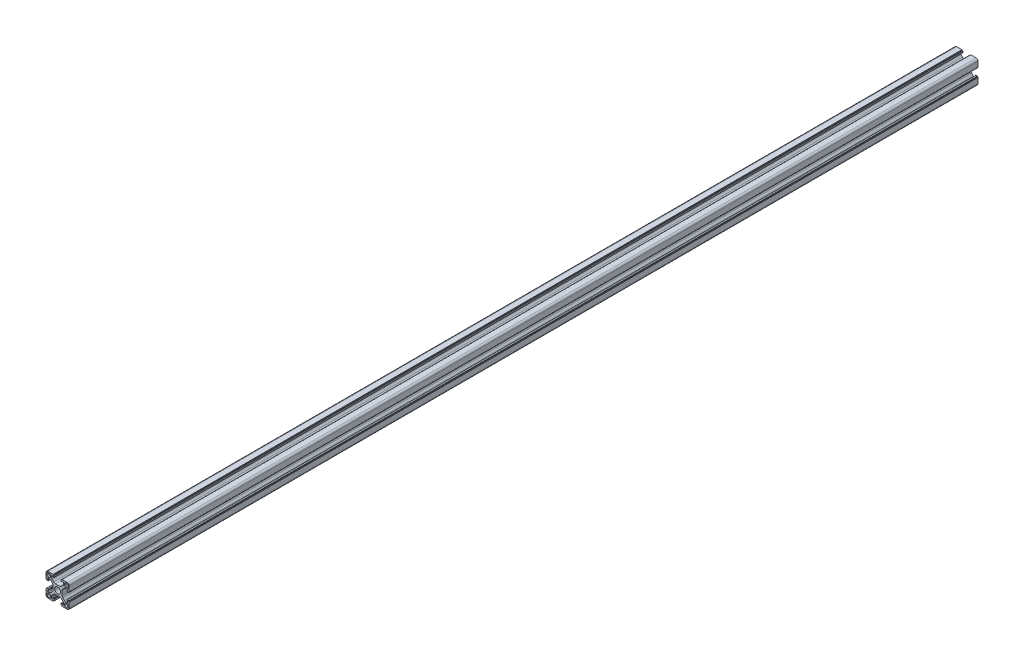
from build123d import *

# Parameters (mm, degrees)
EXTRUDE_1_DEPTH = 784


with BuildPart() as part:
    # Эскиз2 → Бобышка-Вытянуть1 (new body)
    with BuildSketch(Plane.XY):
        with BuildLine():
            Line((0.129852449, 4.683728486), (2.028633118, 4.683728486))
            ThreePointArc((2.028633118, 4.683728486), (2.793999983, 4.835969421), (3.44284668, 5.269514923))
            Line((3.44284668, 5.269514923), (4.744066011, 6.570734254))
            ThreePointArc((4.744066011, 6.570734254), (5.177611514, 7.219580952), (5.329852449, 7.984947817))
            Line((5.329852449, 7.984947817), (5.329852449, 8.883728486))
            ThreePointArc((5.329852449, 8.883728486), (5.183405839, 9.237281876), (4.829852449, 9.383728486))
            Line((4.829852449, 9.383728486), (4.72695923, 9.383728486))
            ThreePointArc((4.72695923, 9.383728486), (4.535617514, 9.345668252), (4.373405839, 9.237281876))
            Line((4.373405839, 9.237281876), (3.893075754, 8.75695179))
            ThreePointArc((3.893075754, 8.75695179), (3.811969916, 8.702758603), (3.716299058, 8.683728486))
            Line((3.716299058, 8.683728486), (3.429852449, 8.683728486))
            ThreePointArc((3.429852449, 8.683728486), (3.253075754, 8.75695179), (3.179852449, 8.933728486))
            Line((3.179852449, 8.933728486), (3.179852449, 10.082799306))
            ThreePointArc((3.179852449, 10.082799306), (3.223786432, 10.188865323), (3.329852449, 10.232799306))
            Line((3.329852449, 10.232799306), (3.829852449, 10.232799306))
            Line((3.829852449, 10.232799306), (3.829852449, 10.533728486))
            ThreePointArc((3.829852449, 10.533728486), (3.873786432, 10.639794503), (3.979852449, 10.683728486))
            Line((3.979852449, 10.683728486), (8.629852449, 10.683728486))
            ThreePointArc((8.629852449, 10.683728486), (9.690512621, 10.244388658), (10.129852449, 9.183728486))
            Line((10.129852449, 9.183728486), (10.129852449, 4.533728486))
            ThreePointArc((10.129852449, 4.533728486), (10.085918466, 4.427662469), (9.979852449, 4.383728486))
            Line((9.979852449, 4.383728486), (9.678923269, 4.383728486))
            Line((9.678923269, 4.383728486), (9.678923269, 3.883728486))
            ThreePointArc((9.678923269, 3.883728486), (9.634989287, 3.777662469), (9.528923269, 3.733728486))
            Line((9.528923269, 3.733728486), (8.379852449, 3.733728486))
            ThreePointArc((8.379852449, 3.733728486), (8.203075754, 3.80695179), (8.129852449, 3.983728486))
            Line((8.129852449, 3.983728486), (8.129852449, 4.270175095))
            ThreePointArc((8.129852449, 4.270175095), (8.148882566, 4.365845953), (8.203075754, 4.44695179))
            Line((8.203075754, 4.44695179), (8.683405839, 4.927281876))
            ThreePointArc((8.683405839, 4.927281876), (8.791792215, 5.089493551), (8.829852449, 5.280835267))
            Line((8.829852449, 5.280835267), (8.829852449, 5.383728486))
            ThreePointArc((8.829852449, 5.383728486), (8.683405839, 5.737281876), (8.329852449, 5.883728486))
            Line((8.329852449, 5.883728486), (7.43107178, 5.883728486))
            ThreePointArc((7.43107178, 5.883728486), (6.665704915, 5.731487551), (6.016858217, 5.297942048))
            Line((6.016858217, 5.297942048), (4.715638886, 3.996722717))
            ThreePointArc((4.715638886, 3.996722717), (4.282093384, 3.34787602), (4.129852449, 2.582509155))
            Line((4.129852449, 2.582509155), (4.129852449, 0.683728486))
            Line((4.129852449, 0.683728486), (4.129852449, -1.215052183))
            ThreePointArc((4.129852449, -1.215052183), (4.282093384, -1.980419048), (4.715638886, -2.629265746))
            Line((4.715638886, -2.629265746), (6.016858217, -3.930485077))
            ThreePointArc((6.016858217, -3.930485077), (6.665704915, -4.364030579), (7.43107178, -4.516271514))
            Line((7.43107178, -4.516271514), (8.329852449, -4.516271514))
            ThreePointArc((8.329852449, -4.516271514), (8.683405839, -4.369824905), (8.829852449, -4.016271514))
            Line((8.829852449, -4.016271514), (8.829852449, -3.913378295))
            ThreePointArc((8.829852449, -3.913378295), (8.791792215, -3.722036579), (8.683405839, -3.559824905))
            Line((8.683405839, -3.559824905), (8.203075754, -3.079494819))
            ThreePointArc((8.203075754, -3.079494819), (8.148882566, -2.998388982), (8.129852449, -2.902718124))
            Line((8.129852449, -2.902718124), (8.129852449, -2.616271514))
            ThreePointArc((8.129852449, -2.616271514), (8.203075754, -2.439494819), (8.379852449, -2.366271514))
            Line((8.379852449, -2.366271514), (9.528923269, -2.366271514))
            ThreePointArc((9.528923269, -2.366271514), (9.634989287, -2.410205497), (9.678923269, -2.516271514))
            Line((9.678923269, -2.516271514), (9.678923269, -3.016271514))
            Line((9.678923269, -3.016271514), (9.979852449, -3.016271514))
            ThreePointArc((9.979852449, -3.016271514), (10.085918466, -3.060205497), (10.129852449, -3.166271514))
            Line((10.129852449, -3.166271514), (10.129852449, -7.816271514))
            ThreePointArc((10.129852449, -7.816271514), (9.690512621, -8.876931686), (8.629852449, -9.316271514))
            Line((8.629852449, -9.316271514), (3.979852449, -9.316271514))
            ThreePointArc((3.979852449, -9.316271514), (3.873786432, -9.272337531), (3.829852449, -9.166271514))
            Line((3.829852449, -9.166271514), (3.829852449, -8.865342335))
            Line((3.829852449, -8.865342335), (3.329852449, -8.865342335))
            ThreePointArc((3.329852449, -8.865342335), (3.223786432, -8.821408352), (3.179852449, -8.715342335))
            Line((3.179852449, -8.715342335), (3.179852449, -7.566271514))
            ThreePointArc((3.179852449, -7.566271514), (3.253075754, -7.389494819), (3.429852449, -7.316271514))
            Line((3.429852449, -7.316271514), (3.716299058, -7.316271514))
            ThreePointArc((3.716299058, -7.316271514), (3.811969916, -7.335301631), (3.893075754, -7.389494819))
            Line((3.893075754, -7.389494819), (4.373405839, -7.869824905))
            ThreePointArc((4.373405839, -7.869824905), (4.535617514, -7.978211281), (4.72695923, -8.016271514))
            Line((4.72695923, -8.016271514), (4.829852449, -8.016271514))
            ThreePointArc((4.829852449, -8.016271514), (5.183405839, -7.869824905), (5.329852449, -7.516271514))
            Line((5.329852449, -7.516271514), (5.329852449, -6.617490845))
            ThreePointArc((5.329852449, -6.617490845), (5.177611514, -5.85212398), (4.744066011, -5.203277283))
            Line((4.744066011, -5.203277283), (3.44284668, -3.902057952))
            ThreePointArc((3.44284668, -3.902057952), (2.793999983, -3.468512449), (2.028633118, -3.316271514))
            Line((2.028633118, -3.316271514), (0.129852449, -3.316271514))
            Line((0.129852449, -3.316271514), (-1.76892822, -3.316271514))
            ThreePointArc((-1.76892822, -3.316271514), (-2.534295085, -3.468512449), (-3.183141783, -3.902057952))
            Line((-3.183141783, -3.902057952), (-4.484361114, -5.203277283))
            ThreePointArc((-4.484361114, -5.203277283), (-4.917906616, -5.85212398), (-5.070147551, -6.617490845))
            Line((-5.070147551, -6.617490845), (-5.070147551, -7.516271514))
            ThreePointArc((-5.070147551, -7.516271514), (-4.923700942, -7.869824905), (-4.570147551, -8.016271514))
            Line((-4.570147551, -8.016271514), (-4.467254332, -8.016271514))
            ThreePointArc((-4.467254332, -8.016271514), (-4.275912616, -7.978211281), (-4.113700942, -7.869824905))
            Line((-4.113700942, -7.869824905), (-3.633370856, -7.389494819))
            ThreePointArc((-3.633370856, -7.389494819), (-3.552265019, -7.335301631), (-3.456594161, -7.316271514))
            Line((-3.456594161, -7.316271514), (-3.170147551, -7.316271514))
            ThreePointArc((-3.170147551, -7.316271514), (-2.993370856, -7.389494819), (-2.920147551, -7.566271514))
            Line((-2.920147551, -7.566271514), (-2.920147551, -8.715342335))
            ThreePointArc((-2.920147551, -8.715342335), (-2.964081534, -8.821408352), (-3.070147551, -8.865342335))
            Line((-3.070147551, -8.865342335), (-3.570147551, -8.865342335))
            Line((-3.570147551, -8.865342335), (-3.570147551, -9.166271514))
            ThreePointArc((-3.570147551, -9.166271514), (-3.614081534, -9.272337531), (-3.720147551, -9.316271514))
            Line((-3.720147551, -9.316271514), (-8.370147551, -9.316271514))
            ThreePointArc((-8.370147551, -9.316271514), (-9.430807723, -8.876931686), (-9.870147551, -7.816271514))
            Line((-9.870147551, -7.816271514), (-9.870147551, -3.166271514))
            ThreePointArc((-9.870147551, -3.166271514), (-9.826213568, -3.060205497), (-9.720147551, -3.016271514))
            Line((-9.720147551, -3.016271514), (-9.419218372, -3.016271514))
            Line((-9.419218372, -3.016271514), (-9.419218372, -2.516271514))
            ThreePointArc((-9.419218372, -2.516271514), (-9.375284389, -2.410205497), (-9.269218372, -2.366271514))
            Line((-9.269218372, -2.366271514), (-8.120147551, -2.366271514))
            ThreePointArc((-8.120147551, -2.366271514), (-7.943370856, -2.439494819), (-7.870147551, -2.616271514))
            Line((-7.870147551, -2.616271514), (-7.870147551, -2.902718124))
            ThreePointArc((-7.870147551, -2.902718124), (-7.889177668, -2.998388982), (-7.943370856, -3.079494819))
            Line((-7.943370856, -3.079494819), (-8.423700942, -3.559824905))
            ThreePointArc((-8.423700942, -3.559824905), (-8.532087317, -3.722036579), (-8.570147551, -3.913378295))
            Line((-8.570147551, -3.913378295), (-8.570147551, -4.016271514))
            ThreePointArc((-8.570147551, -4.016271514), (-8.423700942, -4.369824905), (-8.070147551, -4.516271514))
            Line((-8.070147551, -4.516271514), (-7.171366882, -4.516271514))
            ThreePointArc((-7.171366882, -4.516271514), (-6.406000017, -4.364030579), (-5.75715332, -3.930485077))
            Line((-5.75715332, -3.930485077), (-4.455933989, -2.629265746))
            ThreePointArc((-4.455933989, -2.629265746), (-4.022388486, -1.980419048), (-3.870147551, -1.215052183))
            Line((-3.870147551, -1.215052183), (-3.870147551, 0.683728486))
            Line((-3.870147551, 0.683728486), (-3.870147551, 2.582509155))
            ThreePointArc((-3.870147551, 2.582509155), (-4.022388486, 3.34787602), (-4.455933989, 3.996722717))
            Line((-4.455933989, 3.996722717), (-5.75715332, 5.297942048))
            ThreePointArc((-5.75715332, 5.297942048), (-6.406000017, 5.731487551), (-7.171366882, 5.883728486))
            Line((-7.171366882, 5.883728486), (-8.070147551, 5.883728486))
            ThreePointArc((-8.070147551, 5.883728486), (-8.423700942, 5.737281876), (-8.570147551, 5.383728486))
            Line((-8.570147551, 5.383728486), (-8.570147551, 5.280835267))
            ThreePointArc((-8.570147551, 5.280835267), (-8.532087317, 5.089493551), (-8.423700942, 4.927281876))
            Line((-8.423700942, 4.927281876), (-7.943370856, 4.44695179))
            ThreePointArc((-7.943370856, 4.44695179), (-7.889177668, 4.365845953), (-7.870147551, 4.270175095))
            Line((-7.870147551, 4.270175095), (-7.870147551, 3.983728486))
            ThreePointArc((-7.870147551, 3.983728486), (-7.943370856, 3.80695179), (-8.120147551, 3.733728486))
            Line((-8.120147551, 3.733728486), (-9.269218372, 3.733728486))
            ThreePointArc((-9.269218372, 3.733728486), (-9.375284389, 3.777662469), (-9.419218372, 3.883728486))
            Line((-9.419218372, 3.883728486), (-9.419218372, 4.383728486))
            Line((-9.419218372, 4.383728486), (-9.720147551, 4.383728486))
            ThreePointArc((-9.720147551, 4.383728486), (-9.826213568, 4.427662469), (-9.870147551, 4.533728486))
            Line((-9.870147551, 4.533728486), (-9.870147551, 9.183728486))
            ThreePointArc((-9.870147551, 9.183728486), (-9.430807723, 10.244388658), (-8.370147551, 10.683728486))
            Line((-8.370147551, 10.683728486), (-3.720147551, 10.683728486))
            ThreePointArc((-3.720147551, 10.683728486), (-3.614081534, 10.639794503), (-3.570147551, 10.533728486))
            Line((-3.570147551, 10.533728486), (-3.570147551, 10.232799306))
            Line((-3.570147551, 10.232799306), (-3.070147551, 10.232799306))
            ThreePointArc((-3.070147551, 10.232799306), (-2.964081534, 10.188865323), (-2.920147551, 10.082799306))
            Line((-2.920147551, 10.082799306), (-2.920147551, 8.933728486))
            ThreePointArc((-2.920147551, 8.933728486), (-2.993370856, 8.75695179), (-3.170147551, 8.683728486))
            Line((-3.170147551, 8.683728486), (-3.456594161, 8.683728486))
            ThreePointArc((-3.456594161, 8.683728486), (-3.552265019, 8.702758603), (-3.633370856, 8.75695179))
            Line((-3.633370856, 8.75695179), (-4.113700942, 9.237281876))
            ThreePointArc((-4.113700942, 9.237281876), (-4.275912616, 9.345668252), (-4.467254332, 9.383728486))
            Line((-4.467254332, 9.383728486), (-4.570147551, 9.383728486))
            ThreePointArc((-4.570147551, 9.383728486), (-4.923700942, 9.237281876), (-5.070147551, 8.883728486))
            Line((-5.070147551, 8.883728486), (-5.070147551, 7.984947817))
            ThreePointArc((-5.070147551, 7.984947817), (-4.917906616, 7.219580952), (-4.484361114, 6.570734254))
            Line((-4.484361114, 6.570734254), (-3.183141783, 5.269514923))
            ThreePointArc((-3.183141783, 5.269514923), (-2.534295085, 4.835969421), (-1.76892822, 4.683728486))
            Line((-1.76892822, 4.683728486), (0.129852449, 4.683728486))
        make_face()
        with BuildLine():
            Line((7.029852449, 6.783728486), (8.429852449, 6.783728486))
            ThreePointArc((8.429852449, 6.783728486), (8.995537874, 7.018043061), (9.229852449, 7.583728486))
            Line((9.229852449, 7.583728486), (9.229852449, 8.983728486))
            ThreePointArc((9.229852449, 8.983728486), (8.995537874, 9.549413911), (8.429852449, 9.783728486))
            Line((8.429852449, 9.783728486), (7.029852449, 9.783728486))
            ThreePointArc((7.029852449, 9.783728486), (6.464167024, 9.549413911), (6.229852449, 8.983728486))
            Line((6.229852449, 8.983728486), (6.229852449, 7.583728486))
            ThreePointArc((6.229852449, 7.583728486), (6.464167024, 7.018043061), (7.029852449, 6.783728486))
        make_face(mode=Mode.SUBTRACT)
        with BuildLine():
            Line((6.229852449, -6.216271514), (6.229852449, -7.616271514))
            ThreePointArc((6.229852449, -7.616271514), (6.464167024, -8.181956939), (7.029852449, -8.416271514))
            Line((7.029852449, -8.416271514), (8.429852449, -8.416271514))
            ThreePointArc((8.429852449, -8.416271514), (8.995537874, -8.181956939), (9.229852449, -7.616271514))
            Line((9.229852449, -7.616271514), (9.229852449, -6.216271514))
            ThreePointArc((9.229852449, -6.216271514), (8.995537874, -5.650586089), (8.429852449, -5.416271514))
            Line((8.429852449, -5.416271514), (7.029852449, -5.416271514))
            ThreePointArc((7.029852449, -5.416271514), (6.464167024, -5.650586089), (6.229852449, -6.216271514))
        make_face(mode=Mode.SUBTRACT)
        with BuildLine():
            Line((-6.770147551, -5.416271514), (-8.170147551, -5.416271514))
            ThreePointArc((-8.170147551, -5.416271514), (-8.735832976, -5.650586089), (-8.970147551, -6.216271514))
            Line((-8.970147551, -6.216271514), (-8.970147551, -7.616271514))
            ThreePointArc((-8.970147551, -7.616271514), (-8.735832976, -8.181956939), (-8.170147551, -8.416271514))
            Line((-8.170147551, -8.416271514), (-6.770147551, -8.416271514))
            ThreePointArc((-6.770147551, -8.416271514), (-6.204462126, -8.181956939), (-5.970147551, -7.616271514))
            Line((-5.970147551, -7.616271514), (-5.970147551, -6.216271514))
            ThreePointArc((-5.970147551, -6.216271514), (-6.204462126, -5.650586089), (-6.770147551, -5.416271514))
        make_face(mode=Mode.SUBTRACT)
        with BuildLine():
            Line((-5.970147551, 7.583728486), (-5.970147551, 8.983728486))
            ThreePointArc((-5.970147551, 8.983728486), (-6.204462126, 9.549413911), (-6.770147551, 9.783728486))
            Line((-6.770147551, 9.783728486), (-8.170147551, 9.783728486))
            ThreePointArc((-8.170147551, 9.783728486), (-8.735832976, 9.549413911), (-8.970147551, 8.983728486))
            Line((-8.970147551, 8.983728486), (-8.970147551, 7.583728486))
            ThreePointArc((-8.970147551, 7.583728486), (-8.735832976, 7.018043061), (-8.170147551, 6.783728486))
            Line((-8.170147551, 6.783728486), (-6.770147551, 6.783728486))
            ThreePointArc((-6.770147551, 6.783728486), (-6.204462126, 7.018043061), (-5.970147551, 7.583728486))
        make_face(mode=Mode.SUBTRACT)
        with BuildLine():
            ThreePointArc((2.629852449, 0.683728486), (1.897619402, 2.451495439), (0.129852449, 3.183728486))
            ThreePointArc((0.129852449, 3.183728486), (-1.637914504, 2.451495439), (-2.370147551, 0.683728486))
            ThreePointArc((-2.370147551, 0.683728486), (-1.637914504, -1.084038467), (0.129852449, -1.816271514))
            ThreePointArc((0.129852449, -1.816271514), (1.897619402, -1.084038467), (2.629852449, 0.683728486))
        make_face(mode=Mode.SUBTRACT)
    extrude(amount=EXTRUDE_1_DEPTH)


solid = part.part
